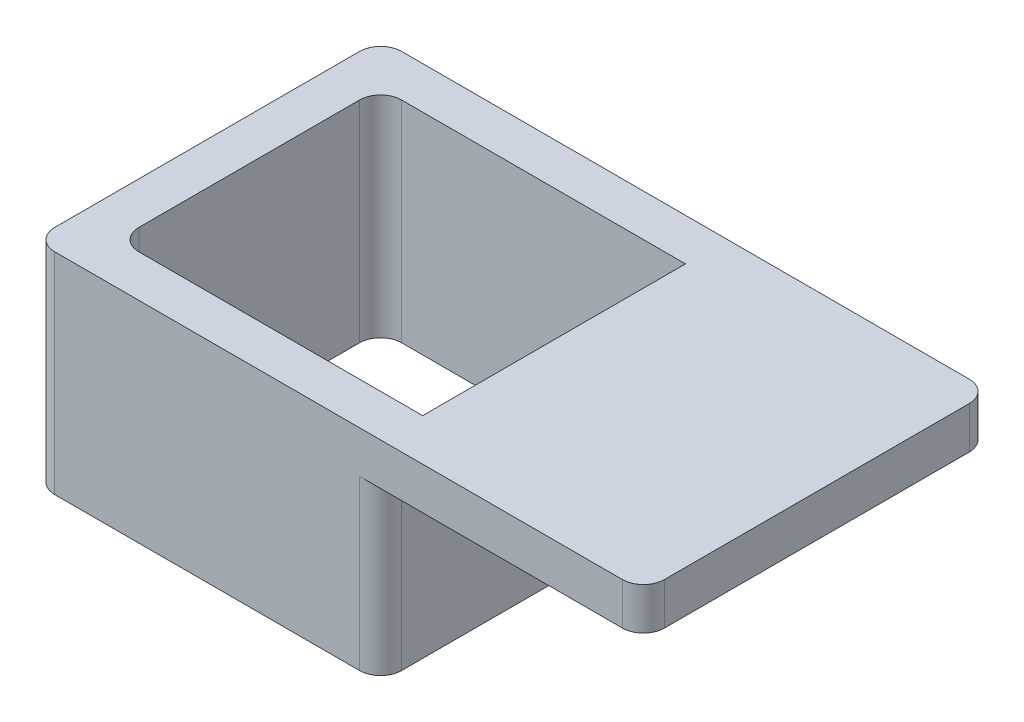
from build123d import *

# Parameters (mm, degrees)
CROQUIS1_W              = 16.5
CROQUIS1_H              = 16.5
CROQUIS1_W_2            = 12.5
CROQUIS1_H_2            = 12.5
SALIENTE_EXTRUIR1_DEPTH = 10
CHAFL_N1_SIZE           = 2
CROQUIS2_W              = 16.5
CROQUIS2_H              = 2
SALIENTE_EXTRUIR2_DEPTH = 12.5
REDONDEO1_R             = 1


with BuildPart() as part:
    # Croquis1 → Saliente-Extruir1 (new body)
    with BuildSketch(Plane(origin=(0, 0, 0), x_dir=(1, 0, 0), z_dir=(0, 1, 0))):
        Rectangle(CROQUIS1_W, CROQUIS1_H)
        Rectangle(CROQUIS1_W_2, CROQUIS1_H_2, mode=Mode.SUBTRACT)
    extrude(amount=SALIENTE_EXTRUIR1_DEPTH)

    # Chaflán1
    chafl_n1_edges = [part.edges().sort_by_distance(p)[0] for p in [
        (6.25, 10, 0),
    ]]
    chamfer(chafl_n1_edges, length=CHAFL_N1_SIZE - 0.0001)  # a hair under: the kernel refuses the full size

    # Croquis2 → Saliente-Extruir2 (add)
    with BuildSketch(Plane(origin=(8.25, 0, 0), x_dir=(0, 0, -1), z_dir=(1, 0, 0))):
        with Locations((0, 9)):
            Rectangle(CROQUIS2_W, CROQUIS2_H)
    extrude(amount=SALIENTE_EXTRUIR2_DEPTH)

    # Redondeo1
    redondeo1_edges = [part.edges().sort_by_distance(p)[0] for p in [
        (-6.25, 5, -6.25),
        (-6.25, 5, 6.25),
        (8.25, 4, -8.25),
        (8.25, 4, 8.25),
        (20.75, 9, 8.25),
        (20.75, 9, -8.25),
        (-8.25, 5, -8.25),
        (-8.25, 5, 8.25),
    ]]
    fillet(redondeo1_edges, radius=REDONDEO1_R)


solid = part.part
